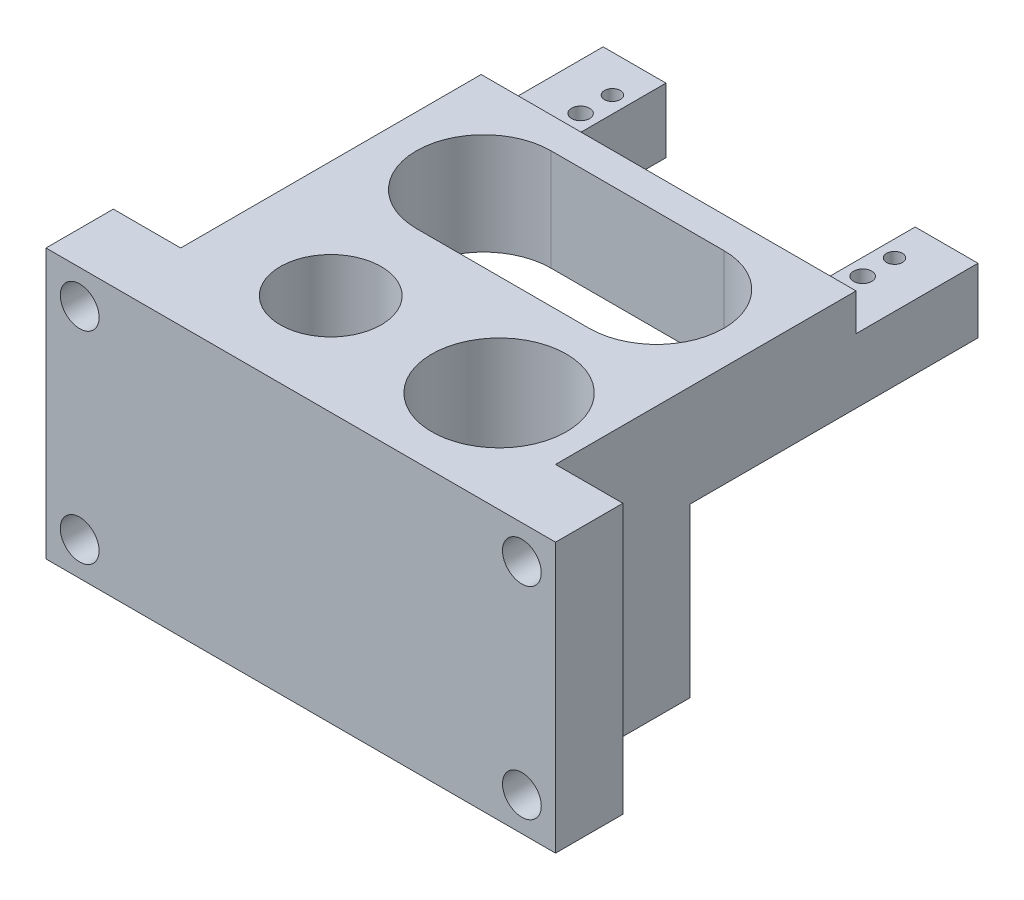
from build123d import *

# Parameters (mm, degrees)
EXTRUDE_START               = 15.8125
EXTRUDE_1_OUTLINE_W         = 35.35
EXTRUDE_1_OUTLINE_H         = 28.3375
EXTRUDE_1_DEPTH             = 9.5875
SKETCH_2_W                  = 35.35
SKETCH_2_H                  = 12.7
EXTRUDE_2_DEPTH             = 15.8125
SKETCH_3_W                  = 48.05
SKETCH_3_H                  = 25.4
EXTRUDE_3_DEPTH             = 6.35
SKETCH_4_W                  = 5.925
SKETCH_4_H                  = 6.096
EXTRUDE_4_DEPTH             = 11.5
SKETCH_5_W                  = 5.925
SKETCH_5_H                  = 6.096
EXTRUDE_5_DEPTH             = 11.5
HOLE_WIZARD_1_D             = 3.6576
HOLE_WIZARD_1_DEPTH         = 46.1875
HOLE_WIZARD_2_D             = 3.6576
HOLE_WIZARD_M8_1_D          = 9.525
HOLE_WIZARD_3_D             = 12.7
HOLE_WIZARD_M1_6_1_D        = 1.778
HOLE_WIZARD_M1_6_1_DEPTH    = 6.440714286
HOLE_WIZARD_M1_6_1_TIP      = 0.53416509
HOLE_WIZARD_1_7_1_7_1_D     = 1.7
HOLE_WIZARD_1_7_1_7_1_DEPTH = 9.5875
HOLE_WIZARD_1_5_1_5_1_D     = 1.5
HOLE_WIZARD_1_5_1_5_1_DEPTH = 21.9085


with BuildPart() as part:
    # 凸台-拉伸1: read off the stored shape, not the designer's step
    # 凸台-拉伸1 outline → 凸台-拉伸1 (new body)
    with BuildSketch(Plane(origin=(0, 0, 0), x_dir=(1, 0, 0), z_dir=(0, 1, 0)).offset(EXTRUDE_START)):
        with Locations((6.7, 10.99375)):
            Rectangle(EXTRUDE_1_OUTLINE_W, EXTRUDE_1_OUTLINE_H)
        with BuildLine():
            Line((14.85, 9.525), (-1.45, 9.525))
            ThreePointArc((-1.45, 9.525), (-7.8, 15.875), (-1.45, 22.225))
            Line((-1.45, 22.225), (14.85, 22.225))
            ThreePointArc((14.85, 22.225), (21.2, 15.875), (14.85, 9.525))
        make_face(mode=Mode.SUBTRACT)
    extrude(amount=EXTRUDE_1_DEPTH)

    # 草图2 → 凸台-拉伸2 (add)
    with BuildSketch(Plane.XZ.offset(-15.8125)):
        with Locations((6.7, -3.175)):
            Rectangle(SKETCH_2_W, SKETCH_2_H)
    extrude(amount=EXTRUDE_2_DEPTH)

    # 草图3 → 凸台-拉伸3 (add)
    with BuildSketch(Plane.XY.offset(3.175)):
        with Locations((6.7, 12.7)):
            Rectangle(SKETCH_3_W, SKETCH_3_H)
    extrude(amount=EXTRUDE_3_DEPTH)

    # 草图4 → 凸台-拉伸4 (add)
    with BuildSketch(Plane(origin=(0, 0, -25.1625), x_dir=(-1, 0, 0), z_dir=(0, 0, -1))):
        with Locations((-21.4125, 18.8605)):
            Rectangle(SKETCH_4_W, SKETCH_4_H)
    extrude(amount=EXTRUDE_4_DEPTH)

    # 草图5 → 凸台-拉伸5 (add)
    with BuildSketch(Plane(origin=(0, 0, -25.1625), x_dir=(-1, 0, 0), z_dir=(0, 0, -1))):
        with Locations((8.0125, 18.8605)):
            Rectangle(SKETCH_5_W, SKETCH_5_H)
    extrude(amount=EXTRUDE_5_DEPTH)

    # 孔1
    with Locations(Plane.XY.offset(9.525)):
        with Locations((27.55, 22.225), (27.55, 3.175)):
            Hole(HOLE_WIZARD_1_D / 2, depth=HOLE_WIZARD_1_DEPTH)

    # 孔2 (through all)
    with Locations(Plane(origin=(0, 0, 3.175), x_dir=(-1, 0, 0), z_dir=(0, 0, -1))):
        with Locations((14.15, 3.175), (14.15, 22.225)):
            Hole(HOLE_WIZARD_2_D / 2)

    # M8 间隙孔1 (through all)
    with Locations(Plane(origin=(0, 25.4, 0), x_dir=(1, 0, 0), z_dir=(0, 1, 0))):
        with Locations((0, 0)):
            Hole(HOLE_WIZARD_M8_1_D / 2)

    # 孔3 (through all)
    with Locations(Plane(origin=(0, 0, 0), x_dir=(-1, 0, 0), z_dir=(0, -1, 0))):
        with Locations((-15.875, 0)):
            Hole(HOLE_WIZARD_3_D / 2)

    # M1.6 间隙孔1
    with Locations(Plane(origin=(0, 0, 0), x_dir=(-1, 0, 0), z_dir=(0, -1, 0))):
        with Locations((9.705, -6.35), (8.475, 6.525), (-21.875, 6.525), (-23.105, -6.35)):
            Hole(HOLE_WIZARD_M1_6_1_D / 2, depth=HOLE_WIZARD_M1_6_1_DEPTH)
            with Locations((0, 0, -(HOLE_WIZARD_M1_6_1_DEPTH + HOLE_WIZARD_M1_6_1_TIP / 2))):  # 118° drill point
                Cone(0, HOLE_WIZARD_M1_6_1_D / 2, HOLE_WIZARD_M1_6_1_TIP, mode=Mode.SUBTRACT)

    # Ø1.7 (1.7) 直径孔1
    with Locations(Plane(origin=(0, 15.8125, 0), x_dir=(-1, 0, 0), z_dir=(0, -1, 0))):
        with Locations((-20, 30.1625), (6.6, 30.1625)):
            Hole(HOLE_WIZARD_1_7_1_7_1_D / 2, depth=HOLE_WIZARD_1_7_1_7_1_DEPTH)

    # Ø1.5 (1.5) 直径孔1
    with Locations(Plane(origin=(0, 21.9085, 0), x_dir=(1, 0, 0), z_dir=(0, 1, 0))):
        with Locations((20, 33.1625), (-6.6, 33.1625)):
            Hole(HOLE_WIZARD_1_5_1_5_1_D / 2, depth=HOLE_WIZARD_1_5_1_5_1_DEPTH)


solid = part.part
